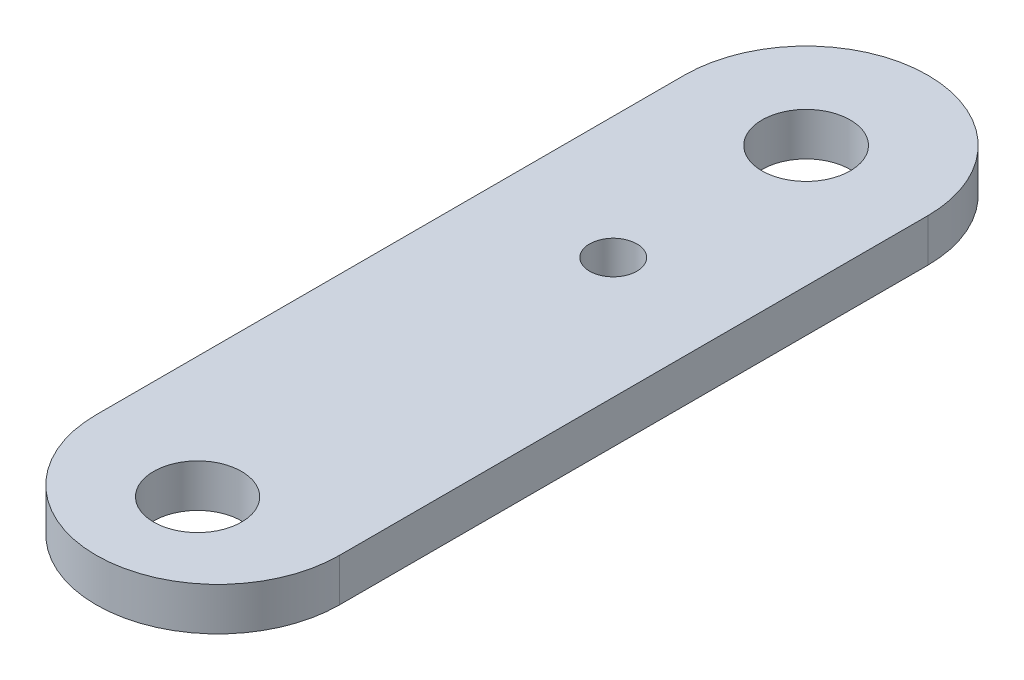
from build123d import *

# Parameters (mm, degrees)
SKETCH1_R          = 3.25
SKETCH1_R_2        = 3.2639
BASE_FLANGE1_DEPTH = 3.175
CUT_EXTRUDE1_REACH = 56.837
SKETCH2_R          = 1.75


# Sheet-metal steps are written as plain solids
with BuildPart() as part:
    # Sketch1 → Base-Flange1 (new body)
    with BuildSketch(Plane(origin=(0, 0, 0), x_dir=(1, 0, 0), z_dir=(0, 1, 0))):
        with BuildLine():
            Line((9, 1.5), (9, 45))
            ThreePointArc((9, 45), (0, 54), (-9, 45))
            Line((-9, 45), (-9, 1.5))
            ThreePointArc((-9, 1.5), (0, -7.5), (9, 1.5))
        make_face()
        with Locations(Location((0, 0, 0), (0, 0, 270))):
            Circle(SKETCH1_R, mode=Mode.SUBTRACT)
        with Locations(Location((0, 45, 0), (0, 0, 270))):
            Circle(SKETCH1_R_2, mode=Mode.SUBTRACT)
    extrude(amount=-BASE_FLANGE1_DEPTH)

    # Sketch2 → Cut-Extrude1 (cut, up to next)
    with BuildSketch(Plane.XZ.offset(3.175), mode=Mode.PRIVATE) as cut_extrude1_sk1:
        with Locations(Location((0.05, -30.687503986, 0), (0, 0, 270))):
            Circle(SKETCH2_R)
    cut_extrude1_tool1 = extrude(cut_extrude1_sk1.sketch, amount=-CUT_EXTRUDE1_REACH, mode=Mode.PRIVATE) & part.part
    add(cut_extrude1_tool1.solids().sort_by_distance((0.05, -3.175, -30.687504))[0], mode=Mode.SUBTRACT)


solid = part.part
